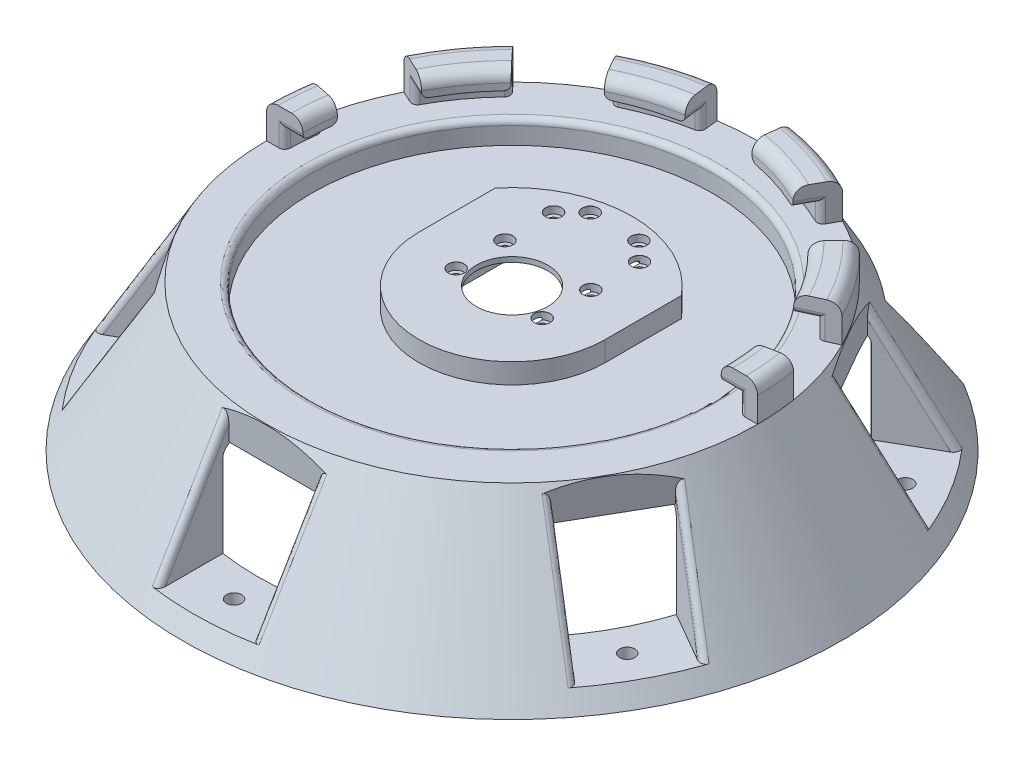
from build123d import *

# Parameters (mm, degrees)
SKETCH2_R                       = 12.5
CUT_EXTRUDE1_DEPTH              = 171.457229262
SKETCH3_R                       = 69.999999954
CUT_EXTRUDE2_DEPTH              = 8.000000002
CUT_EXTRUDE5_DEPTH              = 39
SKETCH8_W                       = 31.75
SKETCH8_H                       = 38.1
CUT_EXTRUDE6_DEPTH              = 44.45
CIRPATTERN2_COUNT               = 6
SKETCH9_R                       = 2.649982
CUT_EXTRUDE7_DEPTH              = 171.457229262
CIRPATTERN3_COUNT               = 6
REVOLVE2_ANGLE                  = 180
SKETCH13_W                      = 26.053542
SKETCH13_H                      = 47
CUT_EXTRUDE8_DEPTH              = 9.05
CUT_EXTRUDE9_DEPTH              = 12.7
SKETCH20_W                      = 26.053542
SKETCH20_H                      = 47
CUT_EXTRUDE10_DEPTH             = 6.3
SKETCH3_3_R                     = 12.5
CUT_EXTRUDE11_DEPTH             = 1
CBORE_FOR_M2_5_SHCS1_AT_2_COUNT = 2
CBORE_FOR_M2_5_SHCS1_AT_2_PITCH = 17
CBORE_FOR_M2_5_SHCS1_AT_3_COUNT = 2
CBORE_FOR_M2_5_SHCS1_AT_3_PITCH = 34
CBORE_FOR_M2_5_SHCS1_AT_4_COUNT = 2
CBORE_FOR_M2_5_SHCS1_AT_4_PITCH = 40.820828017
CBORE_FOR_M2_5_SHCS1_AT_5_COUNT = 2
CBORE_FOR_M2_5_SHCS1_AT_5_PITCH = 46.651259361
CBORE_FOR_M2_5_SHCS1_AT_6_COUNT = 2
CBORE_FOR_M2_5_SHCS1_AT_6_PITCH = 45.343136195
CBORE_FOR_M2_5_SHCS1_AT_7_COUNT = 2
CBORE_FOR_M2_5_SHCS1_AT_7_PITCH = 34.481879299
CBORE_FOR_M2_5_SHCS1_AT_8_COUNT = 2
CBORE_FOR_M2_5_SHCS1_AT_8_PITCH = 30
FILLET1_R                       = 4
FILLET2_R                       = 2
FILLET3_R                       = 2
FILLET4_R                       = 2
FILLET5_R                       = 2
FILLET6_R                       = 4
FILLET7_R                       = 4
FILLET8_R                       = 4
FILLET9_R                       = 1


# Some blends are built 0.0001 mm under size
with BuildPart() as part:
    # Sketch1 → Revolve1 (revolve)
    with BuildSketch(Plane.XY, mode=Mode.PRIVATE) as revolve1_sk:
        Polygon((0, 0), (-85.725, 0), (-115.054393675, -50.8), (0, -50.8), align=None)
    revolve(revolve1_sk.sketch.rotate(Axis((0, 0, 0), (0, -1, 0)), 270), axis=Axis((0, 0, 0), (0, -1, 0)))

    # Sketch2 → Cut-Extrude1 (cut, through all)
    with BuildSketch(Plane(origin=(0, 0, 0), x_dir=(1, 0, 0), z_dir=(0, 1, 0))):
        with Locations(Location((0, 0, 0), (0, 0, 270))):
            Circle(SKETCH2_R)
    extrude(amount=-CUT_EXTRUDE1_DEPTH, mode=Mode.SUBTRACT)

    # Sketch3 → Cut-Extrude2 (cut)
    with BuildSketch(Plane(origin=(0, 0, 0), x_dir=(1, 0, 0), z_dir=(0, 1, 0))):
        with Locations(Location((0, 0, 0), (0, 0, 270))):
            Circle(SKETCH3_R)
        with BuildLine():
            ThreePointArc((32.5, 0), (0, -32.5), (-32.5, 0))
            Line((-32.5, 0), (-32.5, 26.603571189))
            ThreePointArc((-32.5, 26.603571189), (0, 42), (32.5, 26.603571189))
            Line((32.5, 26.603571189), (32.5, 0))
        make_face(mode=Mode.SUBTRACT)
    extrude(amount=-CUT_EXTRUDE2_DEPTH, mode=Mode.SUBTRACT)

    # Sketch7 → Cut-Extrude5 (cut)
    with BuildSketch(Plane.XZ.offset(50.8)):
        with BuildLine():
            Line((-62.664330968, -63.058636397), (-62.664330968, -115.023540392))
            Line((-62.664330968, -115.023540392), (57.335669032, -115.023540392))
            Line((57.335669032, -115.023540392), (57.335669032, -67.939907688))
            ThreePointArc((57.335669032, -67.939907688), (3.613220428, 88.826542419), (-62.664330968, -63.058636397))
        make_face()
    extrude(amount=-CUT_EXTRUDE5_DEPTH, mode=Mode.SUBTRACT)


with BuildPart() as cut_extrude5_piece_1:
    # of the separate pieces the step leaves, piece 1, a body of its own (cut_extrude5_pieces)
    add(part.part.solids().sort_by_distance((0, 0, 85.725))[0])

    # Sketch8 → Cut-Extrude6 (cut)
    with BuildSketch(Plane(origin=(0, 0, 0), x_dir=(1, 0, 0), z_dir=(0, 1, 0))):
        with Locations((2.847721453, -104.875)):
            Rectangle(SKETCH8_W, SKETCH8_H)
    cut_extrude6 = extrude(amount=-CUT_EXTRUDE6_DEPTH, mode=Mode.SUBTRACT)

    # CirPattern2: Cut-Extrude6 ×6 about axis, 1 skipped
    cirpattern2_axis = Axis((0, 0, 0), (0, -1, 0))
    add([cut_extrude6.rotate(cirpattern2_axis, i * 360 / CIRPATTERN2_COUNT) for i in range(1, CIRPATTERN2_COUNT) if i not in (3,)], mode=Mode.SUBTRACT)

    # Sketch9 → Cut-Extrude7 (cut, through all)
    with BuildSketch(Plane(origin=(0, 0, 0), x_dir=(1, 0, 0), z_dir=(0, 1, 0))):
        with Locations(Location((2.709157278, -99.772001646, 0), (0, 0, 270))):
            Circle(SKETCH9_R)
    cut_extrude7 = extrude(amount=-CUT_EXTRUDE7_DEPTH, mode=Mode.SUBTRACT)

    # CirPattern3: Cut-Extrude7 ×6 about axis
    cirpattern3_axis = Axis((0, 0, 0), (0, 1, 0))
    for i in range(1, CIRPATTERN3_COUNT):
        add(cut_extrude7.rotate(cirpattern3_axis, i * 360 / CIRPATTERN3_COUNT), mode=Mode.SUBTRACT)

    # Sketch12 → Revolve2 (revolve)
    with BuildSketch(Plane.XY):
        Polygon((85.725, 0), (85.725, 12.7), (73.025, 12.7), (73.025, 6.35), (79.375, 6.35), (79.375, 0), align=None)
    revolve(axis=Axis((0, 0, 0), (0, 1, 0)), revolution_arc=REVOLVE2_ANGLE)

    # Sketch13 → Cut-Extrude8 (cut)
    with BuildSketch(Plane.XZ.offset(11.8)):
        with Locations((0, -10.5)):
            Rectangle(SKETCH13_W, SKETCH13_H)
    extrude(amount=-CUT_EXTRUDE8_DEPTH, mode=Mode.SUBTRACT)

    # Sketch18 → Cut-Extrude9 (cut)
    with BuildSketch(Plane(origin=(0, 12.7, 0), x_dir=(1, 0, 0), z_dir=(0, 1, 0))):
        Polygon((46.643270314, 89.718478222), (70.913780145, 72.084920653), (36.670415564, 35.160782448), (22.108109665, 45.740916989), align=None)
        Polygon((-15, 100), (-9, 50), (9, 50), (15, 100), align=None)
        Polygon((90.470396714, 45.167547182), (99.740906545, 16.635851693), (50.333978764, 6.891341072), (44.771672865, 24.010358365), align=None)
        Polygon((99.740906545, -16.635851693), (90.470396714, -45.167547182), (44.771672865, -24.010358365), (50.333978764, -6.891341072), align=None)
        Polygon((70.913780145, -72.084920653), (46.643270314, -89.718478222), (22.108109665, -45.740916989), (36.670415564, -35.160782448), align=None)
        Polygon((15, -100), (-15, -100), (-9, -50), (9, -50), align=None)
        Polygon((-46.643270314, -89.718478222), (-70.913780145, -72.084920653), (-36.670415564, -35.160782448), (-22.108109665, -45.740916989), align=None)
        Polygon((-90.470396714, -45.167547182), (-99.740906545, -16.635851693), (-50.333978764, -6.891341072), (-44.771672865, -24.010358365), align=None)
        Polygon((-99.740906545, 16.635851693), (-90.470396714, 45.167547182), (-44.771672865, 24.010358365), (-50.333978764, 6.891341072), align=None)
        Polygon((-70.913780145, 72.084920653), (-46.643270314, 89.718478222), (-22.108109665, 45.740916989), (-36.670415564, 35.160782448), align=None)
    extrude(amount=-CUT_EXTRUDE9_DEPTH, mode=Mode.SUBTRACT)

    # Sketch20 → Cut-Extrude10 (cut)
    with BuildSketch(Plane.XZ.offset(11.8)):
        Polygon((-22.5, 20), (-22.5, -33), (-12.5, -40), (12.5, -40), (22.5, -33), (22.5, 20), align=None)
        with Locations((0, -10.5)):
            Rectangle(SKETCH20_W, SKETCH20_H, mode=Mode.SUBTRACT)
    extrude(amount=-CUT_EXTRUDE10_DEPTH, mode=Mode.SUBTRACT)

    # Sketch3<3> → Cut-Extrude11 (cut)
    # profile 1 of 5: a face of its own
    with BuildSketch(Plane(origin=(0, 0, 0), x_dir=(1, 0, 0), z_dir=(0, 1, 0))):
        with BuildLine():
            ThreePointArc((-18.668154703, 26.603571189), (-28.835438507, 14.992247533), (-32.5, 0))
            ThreePointArc((-32.5, 0), (0, -32.5), (32.5, 0))
            ThreePointArc((32.5, 0), (28.835438507, 14.992247533), (18.668154703, 26.603571189))
            Line((18.668154703, 26.603571189), (-18.668154703, 26.603571189))
        make_face()
        with Locations(Location((0, 0, 0), (0, 0, 270))):
            Circle(SKETCH3_3_R, mode=Mode.SUBTRACT)
    # profile 2 of 5: a face of its own
    with BuildSketch(Plane(origin=(0, 0, 0), x_dir=(1, 0, 0), z_dir=(0, 1, 0))):
        with BuildLine():
            Line((-32.5, 26.603571189), (-32.5, 0))
            ThreePointArc((-32.5, 0), (-28.835438507, 14.992247533), (-18.668154703, 26.603571189))
            Line((-18.668154703, 26.603571189), (-32.5, 26.603571189))
        make_face()
    # profile 3 of 5: a face of its own
    with BuildSketch(Plane(origin=(0, 0, 0), x_dir=(1, 0, 0), z_dir=(0, 1, 0))):
        with BuildLine():
            ThreePointArc((18.668154703, 26.603571189), (0, 32.5), (-18.668154703, 26.603571189))
            Line((-18.668154703, 26.603571189), (18.668154703, 26.603571189))
        make_face()
    # profile 4 of 5: a face of its own
    with BuildSketch(Plane(origin=(0, 0, 0), x_dir=(1, 0, 0), z_dir=(0, 1, 0))):
        with BuildLine():
            ThreePointArc((32.5, 26.603571189), (0, 42), (-32.5, 26.603571189))
            Line((-32.5, 26.603571189), (-18.668154703, 26.603571189))
            ThreePointArc((-18.668154703, 26.603571189), (0, 32.5), (18.668154703, 26.603571189))
            Line((18.668154703, 26.603571189), (32.5, 26.603571189))
        make_face()
    # profile 5 of 5: a face of its own
    with BuildSketch(Plane(origin=(0, 0, 0), x_dir=(1, 0, 0), z_dir=(0, 1, 0))):
        with BuildLine():
            ThreePointArc((18.668154703, 26.603571189), (28.835438507, 14.992247533), (32.5, 0))
            Line((32.5, 0), (32.5, 26.603571189))
            Line((32.5, 26.603571189), (18.668154703, 26.603571189))
        make_face()
    extrude(amount=-CUT_EXTRUDE11_DEPTH, mode=Mode.SUBTRACT)

    # Sketch24 → CBORE for M2.5 SHCS1 (revolve, cut)
    with BuildSketch(Plane(origin=(-15, -1, 4.5), x_dir=(0, 0, 1), z_dir=(1, 0, 0))):
        Polygon((0, 0), (0, 49.8), (1.45, 49.8), (1.45, 2.5), (2.75, 2.5), (2.75, 0.025), (2.775, 0), align=None)
    cbore_for_m2_5_shcs1 = revolve(axis=Axis((-15, 5.35, 4.5), (0, -1, 0)), mode=Mode.SUBTRACT)

    # CBORE for M2.5 SHCS1 at 2: CBORE for M2.5 SHCS1 ×2
    with Locations(*[(0, 0, -i * CBORE_FOR_M2_5_SHCS1_AT_2_PITCH) for i in range(1, CBORE_FOR_M2_5_SHCS1_AT_2_COUNT)]):
        add(cbore_for_m2_5_shcs1, mode=Mode.SUBTRACT)

    # CBORE for M2.5 SHCS1 at 3: CBORE for M2.5 SHCS1 ×2
    with Locations(*[(0, 0, -i * CBORE_FOR_M2_5_SHCS1_AT_3_PITCH) for i in range(1, CBORE_FOR_M2_5_SHCS1_AT_3_COUNT)]):
        add(cbore_for_m2_5_shcs1, mode=Mode.SUBTRACT)

    # CBORE for M2.5 SHCS1 at 4: CBORE for M2.5 SHCS1 ×2
    with Locations(*[Vector(0.15923243882462063, 0, -0.9872411207126472) * (i * CBORE_FOR_M2_5_SHCS1_AT_4_PITCH) for i in range(1, CBORE_FOR_M2_5_SHCS1_AT_4_COUNT)]):
        add(cbore_for_m2_5_shcs1, mode=Mode.SUBTRACT)

    # CBORE for M2.5 SHCS1 at 5: CBORE for M2.5 SHCS1 ×2
    with Locations(*[Vector(0.5037377408822789, 0, -0.8638566364917376) * (i * CBORE_FOR_M2_5_SHCS1_AT_5_PITCH) for i in range(1, CBORE_FOR_M2_5_SHCS1_AT_5_COUNT)]):
        add(cbore_for_m2_5_shcs1, mode=Mode.SUBTRACT)

    # CBORE for M2.5 SHCS1 at 6: CBORE for M2.5 SHCS1 ×2
    with Locations(*[Vector(0.6616216370868465, 0, -0.7498378553650925) * (i * CBORE_FOR_M2_5_SHCS1_AT_6_PITCH) for i in range(1, CBORE_FOR_M2_5_SHCS1_AT_6_COUNT)]):
        add(cbore_for_m2_5_shcs1, mode=Mode.SUBTRACT)

    # CBORE for M2.5 SHCS1 at 7: CBORE for M2.5 SHCS1 ×2
    with Locations(*[Vector(0.8700221858486125, 0, -0.4930125719808802) * (i * CBORE_FOR_M2_5_SHCS1_AT_7_PITCH) for i in range(1, CBORE_FOR_M2_5_SHCS1_AT_7_COUNT)]):
        add(cbore_for_m2_5_shcs1, mode=Mode.SUBTRACT)

    # CBORE for M2.5 SHCS1 at 8: CBORE for M2.5 SHCS1 ×2
    with Locations(*[(i * CBORE_FOR_M2_5_SHCS1_AT_8_PITCH, 0, 0) for i in range(1, CBORE_FOR_M2_5_SHCS1_AT_8_COUNT)]):
        add(cbore_for_m2_5_shcs1, mode=Mode.SUBTRACT)

    # Fillet1
    fillet1_edges = [cut_extrude5_piece_1.edges().sort_by_distance(p)[0] for p in [
        (-85.450905057, 12.7, -6.849704366),
        (-72.808821363, 12.7, -5.614815819),
        (-59.078466014, 12.7, -42.923018049),
        (-22.565966014, 12.7, -69.450902102),
        (22.565966014, 12.7, -69.450902102),
        (59.078466014, 12.7, -42.923018049),
        (72.808821363, 12.7, -5.614815819),
        (-69.352981843, 12.7, -50.387890753),
        (-26.490481843, 12.7, -81.529319859),
        (26.490481843, 12.7, -81.529319859),
        (69.352981843, 12.7, -50.387890753),
        (85.450905057, 12.7, -6.849704365),
    ]]
    fillet(fillet1_edges, radius=FILLET1_R)

    # Fillet2
    fillet2_edges = [cut_extrude5_piece_1.edges().sort_by_distance(p)[0] for p in [
        (-76.2, 6.35, 0),
        (76.2, 6.35, 0),
        (67.844410645, 6.35, -34.692369341),
        (75.278944251, 6.35, -11.811227656),
        (34.49561812, 6.35, -67.9446604),
        (53.95947979, 6.35, -53.803337137),
        (-75.278944251, 6.35, -11.811227656),
        (-67.844410645, 6.35, -34.692369341),
        (-53.95947979, 6.35, -53.803337137),
        (-34.49561812, 6.35, -67.9446604),
        (12.029328065, 6.35, -75.24440054),
        (-12.029328065, 6.35, -75.24440054),
    ]]
    fillet(fillet2_edges, radius=FILLET2_R)

    # Fillet3
    fillet3_edges = [cut_extrude5_piece_1.edges().sort_by_distance(p)[0] for p in [
        (-78.396323126, 4.175, -12.426067172),
        (-56.120098678, 4.175, -56.133102082),
        (-70.727816733, 4.175, -36.027303052),
        (-12.407903987, 4.175, -78.399199892),
        (56.120098678, 4.175, -56.133102082),
        (78.396323126, 4.175, -12.426067171),
        (-79.375, 4.175, 0),
        (-36.043688298, 4.175, -70.719468033),
        (12.407903987, 4.175, -78.399199892),
        (36.043688298, 4.175, -70.719468033),
        (70.727816733, 4.175, -36.027303052),
        (79.375, 4.175, 0),
    ]]
    fillet(fillet3_edges, radius=FILLET3_R)

    # Fillet4
    fillet4_edges = [cut_extrude5_piece_1.edges().sort_by_distance(p)[0] for p in [
        (-75.365185269, -24.048119846, 65.131246544),
        (-91.587349698, -23.156988252, 37.835375451),
        (18.722721453, -24.048119846, 97.833788276),
        (-13.027278547, -23.156988252, 98.234659229),
        (94.087906722, -24.048119846, 32.702541732),
        (78.560071151, -23.156988252, 60.399283779),
        (75.365185269, -24.048119846, -65.131246544),
        (91.587349698, -23.156988252, -37.835375451),
        (-94.087906722, -24.048119846, -32.702541732),
        (-78.560071151, -23.156988252, -60.399283779),
    ]]
    fillet(fillet4_edges, radius=FILLET4_R)

    # Fillet5
    fillet5_edges = [cut_extrude5_piece_1.edges().sort_by_distance(p)[0] for p in [
        (0, 0, -69.999999954),
    ]]
    fillet(fillet5_edges, radius=FILLET5_R)

    # Fillet6
    # the kernel refuses this fillet: 4 mm, written as the material it adds along each edge
    with BuildSketch(Plane(origin=(0, -11.8, 0), x_dir=(-0.03456665884949972, 0, 0.9994023944818136), z_dir=(0.9994023944818136, 0, 0.03456665884949972))) as fillet6_piece_1_section:
        with BuildLine():
            CenterArc((88.9 - FILLET6_R, FILLET6_R), FILLET6_R, 270, 90)
            Line((88.9, FILLET6_R), (88.9, 0))
            Line((88.9, 0), (88.9 - FILLET6_R, 0))
        make_face()
    fillet6_piece_1 = revolve(axis=Axis((0, -11.8, 0), (0, -1, 0)), revolution_arc=52.306780187, mode=Mode.PRIVATE)
    fillet6_piece_1 = split(fillet6_piece_1, bisect_by=Plane(origin=(-55.212231486, -12.931781051, 53.495933253), z_dir=(0.5000000000000001, 0, 0.8660254037844386)), keep=Keep.TOP, mode=Mode.PRIVATE)
    fillet6_piece_1 = split(fillet6_piece_1, bisect_by=Plane(origin=(-13.027278547, -12.931781051, 77.377670206), z_dir=(-1, 0, 0)), keep=Keep.TOP, mode=Mode.PRIVATE)
    add(fillet6_piece_1)
    with BuildSketch(Plane(origin=(0, -11.8, 0), x_dir=(0.8827911916489972, 0, -0.4697655925532897), z_dir=(-0.4697655925532897, 0, -0.8827911916489972))) as fillet6_piece_2_section:
        with BuildLine():
            CenterArc((88.9 - FILLET6_R, FILLET6_R), FILLET6_R, 270, 90)
            Line((88.9, FILLET6_R), (88.9, 0))
            Line((88.9, 0), (88.9 - FILLET6_R, 0))
        make_face()
    fillet6_piece_2 = revolve(axis=Axis((0, -11.8, 0), (0, -1, 0)), revolution_arc=52.306780187, mode=Mode.PRIVATE)
    fillet6_piece_2 = split(fillet6_piece_2, bisect_by=Plane(origin=(73.524667357, -12.931781051, -27.406880939), z_dir=(0.5000000000000004, 0, 0.8660254037844384)), keep=Keep.TOP, mode=Mode.PRIVATE)
    fillet6_piece_2 = split(fillet6_piece_2, bisect_by=Plane(origin=(73.934952939, -12.931781051, 21.06722844), z_dir=(0.5000000000000001, 0, -0.8660254037844386)), keep=Keep.TOP, mode=Mode.PRIVATE)
    add(fillet6_piece_2)
    with BuildSketch(Plane(origin=(0, -11.8, 0), x_dir=(0.8482245327994972, 0, 0.5296368019285242), z_dir=(0.5296368019285242, 0, -0.8482245327994972))) as fillet6_piece_3_section:
        with BuildLine():
            CenterArc((88.9 - FILLET6_R, FILLET6_R), FILLET6_R, 270, 90)
            Line((88.9, FILLET6_R), (88.9, 0))
            Line((88.9, 0), (88.9 - FILLET6_R, 0))
        make_face()
    fillet6_piece_3 = revolve(axis=Axis((0, -11.8, 0), (0, -1, 0)), revolution_arc=52.306780187, mode=Mode.PRIVATE)
    fillet6_piece_3 = split(fillet6_piece_3, bisect_by=Plane(origin=(18.722721453, -12.931781051, 74.563161693), z_dir=(1, 0, 0)), keep=Keep.TOP, mode=Mode.PRIVATE)
    fillet6_piece_3 = split(fillet6_piece_3, bisect_by=Plane(origin=(60.49738881, -12.931781051, 49.970789267), z_dir=(-0.5000000000000001, 0, 0.8660254037844386)), keep=Keep.TOP, mode=Mode.PRIVATE)
    add(fillet6_piece_3)
    with BuildSketch(Plane(origin=(0, -11.8, 0), x_dir=(-0.8827911916489969, 0, 0.4697655925532904), z_dir=(0.4697655925532904, 0, 0.8827911916489969))) as fillet6_piece_4_section:
        with BuildLine():
            CenterArc((88.9 - FILLET6_R, FILLET6_R), FILLET6_R, 270, 90)
            Line((88.9, FILLET6_R), (88.9, 0))
            Line((88.9, 0), (88.9 - FILLET6_R, 0))
        make_face()
    fillet6_piece_4 = revolve(axis=Axis((0, -11.8, 0), (0, -1, 0)), revolution_arc=52.306780187, mode=Mode.PRIVATE)
    fillet6_piece_4 = split(fillet6_piece_4, bisect_by=Plane(origin=(-73.524667357, -12.931781051, 27.406880939), z_dir=(-0.5000000000000001, 0, -0.8660254037844386)), keep=Keep.TOP, mode=Mode.PRIVATE)
    fillet6_piece_4 = split(fillet6_piece_4, bisect_by=Plane(origin=(-73.934952939, -12.931781051, -21.06722844), z_dir=(-0.49999999999999983, 0, 0.8660254037844388)), keep=Keep.TOP, mode=Mode.PRIVATE)
    add(fillet6_piece_4)

    # Fillet7
    fillet7_edges = [cut_extrude5_piece_1.edges().sort_by_distance(p)[0] for p in [
        (61.757268531, -11.8, -63.947242189),
    ]]
    fillet(fillet7_edges, radius=FILLET7_R - 0.0001)  # a hair under: the kernel refuses the full size

    # Fillet8
    fillet8_edges = [cut_extrude5_piece_1.edges().sort_by_distance(p)[0] for p in [
        (-66.269671974, -11.8, -59.258253235),
    ]]
    fillet(fillet8_edges, radius=FILLET8_R - 0.0001)  # a hair under: the kernel refuses the full size

    # Fillet9
    fillet9_edges = [cut_extrude5_piece_1.edges().sort_by_distance(p)[0] for p in [
        (57.335669032, -31.144788273, -86.41556122),
        (-62.664330968, -31.083296156, -82.588421552),
    ]]
    fillet(fillet9_edges, radius=FILLET9_R)


with BuildPart() as cut_extrude5_piece_2:
    # of the separate pieces the step leaves, piece 2, a body of its own (cut_extrude5_pieces)
    add(part.part.solids().sort_by_distance((-2.664330968, -50.8, -115.023540392))[0])


solid = Compound([cut_extrude5_piece_1.part, cut_extrude5_piece_2.part])
